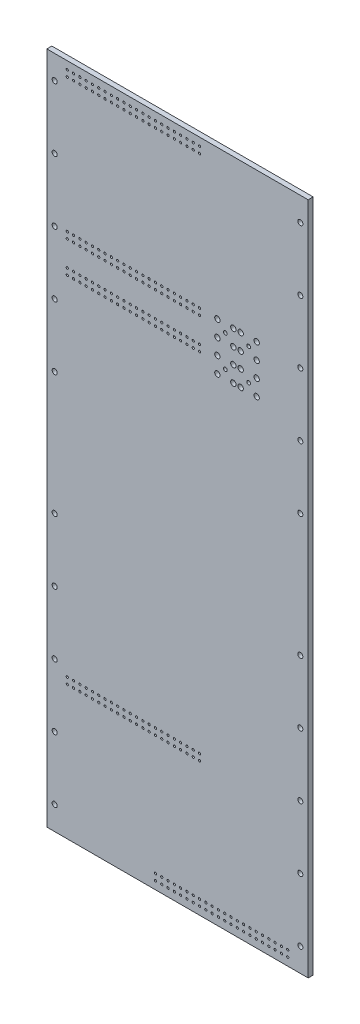
from build123d import *

# Parameters (mm, degrees)
SKETCH1_W                 = 83
SKETCH1_H                 = 214
BOSS_EXTRUDE1_DEPTH       = 1.5875
F_0_CLEARANCE_HOLE1_D     = 1.6129
F_0_CLEARANCE_HOLE1_DEPTH = 3.175
F_0_CLEARANCE_HOLE1_TIP   = 0.484564046
SKETCH6_W                 = 72.5
SKETCH6_H                 = 7
BOSS_EXTRUDE3_DEPTH       = 4.9125
SKETCH7_R                 = 0.35
SKETCH7_R_2               = 0.5842
SKETCH7_R_3               = 0.8509
CUT_EXTRUDE1_DEPTH        = 115.949989126


with BuildPart() as part:
    # Sketch1 → Boss-Extrude1 (new body)
    with BuildSketch(Plane.XY):
        Rectangle(SKETCH1_W, SKETCH1_H)
    extrude(amount=BOSS_EXTRUDE1_DEPTH)

    # #0 Clearance Hole1
    with Locations(Plane.XY.offset(1.5875)):
        with Locations((-39, 99.5), (39, 99.5), (39, 79.5), (39, 59.5), (39, 39.5), (39, 19.5), (-39, 79.5), (-39, 59.5), (-39, 39.5), (-39, 19.5), (-39, -19.5), (-39, -39.5), (-39, -59.5), (-39, -79.5), (39, -19.5), (39, -39.5), (39, -59.5), (39, -79.5), (39, -99.5), (-39, -99.5)):
            Hole(F_0_CLEARANCE_HOLE1_D / 2, depth=F_0_CLEARANCE_HOLE1_DEPTH)
            with Locations((0, 0, -(F_0_CLEARANCE_HOLE1_DEPTH + F_0_CLEARANCE_HOLE1_TIP / 2))):  # 118° drill point
                Cone(0, F_0_CLEARANCE_HOLE1_D / 2, F_0_CLEARANCE_HOLE1_TIP, mode=Mode.SUBTRACT)

    # Sketch6 → Boss-Extrude3 (add)
    with BuildSketch(Plane(origin=(0, 0, 0), x_dir=(-1, 0, 0), z_dir=(0, 0, -1))):
        with Locations((0.05, -3.5)):
            Rectangle(SKETCH6_W, SKETCH6_H)
    extrude(amount=BOSS_EXTRUDE3_DEPTH)

    # Sketch7 → Cut-Extrude1 (cut, through all)
    with BuildSketch(Plane.XY.offset(1.5875)):
        with Locations((-35, 102.5)):
            Circle(SKETCH7_R)
        with Locations((-33, 102.5)):
            Circle(SKETCH7_R)
        with Locations((-31, 102.5)):
            Circle(SKETCH7_R)
        with Locations((-29, 102.5)):
            Circle(SKETCH7_R)
        with Locations((-27, 102.5)):
            Circle(SKETCH7_R)
        with Locations((-25, 102.5)):
            Circle(SKETCH7_R)
        with Locations((-23, 102.5)):
            Circle(SKETCH7_R)
        with Locations((-21, 102.5)):
            Circle(SKETCH7_R)
        with Locations((-19, 102.5)):
            Circle(SKETCH7_R)
        with Locations((-17, 102.5)):
            Circle(SKETCH7_R)
        with Locations((-15, 102.5)):
            Circle(SKETCH7_R)
        with Locations((-13, 102.5)):
            Circle(SKETCH7_R)
        with Locations((-11, 102.5)):
            Circle(SKETCH7_R)
        with Locations((-9, 102.5)):
            Circle(SKETCH7_R)
        with Locations((-7, 102.5)):
            Circle(SKETCH7_R)
        with Locations((-5, 102.5)):
            Circle(SKETCH7_R)
        with Locations((-3, 102.5)):
            Circle(SKETCH7_R)
        with Locations((-1, 102.5)):
            Circle(SKETCH7_R)
        with Locations((1, 102.5)):
            Circle(SKETCH7_R)
        with Locations((3, 102.5)):
            Circle(SKETCH7_R)
        with Locations((5, 102.5)):
            Circle(SKETCH7_R)
        with Locations((7, 102.5)):
            Circle(SKETCH7_R)
        with Locations((-33, 104.5)):
            Circle(SKETCH7_R)
        with Locations((-31, 104.5)):
            Circle(SKETCH7_R)
        with Locations((-29, 104.5)):
            Circle(SKETCH7_R)
        with Locations((-27, 104.5)):
            Circle(SKETCH7_R)
        with Locations((-25, 104.5)):
            Circle(SKETCH7_R)
        with Locations((-23, 104.5)):
            Circle(SKETCH7_R)
        with Locations((-21, 104.5)):
            Circle(SKETCH7_R)
        with Locations((-19, 104.5)):
            Circle(SKETCH7_R)
        with Locations((-17, 104.5)):
            Circle(SKETCH7_R)
        with Locations((-15, 104.5)):
            Circle(SKETCH7_R)
        with Locations((-13, 104.5)):
            Circle(SKETCH7_R)
        with Locations((-11, 104.5)):
            Circle(SKETCH7_R)
        with Locations((-9, 104.5)):
            Circle(SKETCH7_R)
        with Locations((-7, 104.5)):
            Circle(SKETCH7_R)
        with Locations((-5, 104.5)):
            Circle(SKETCH7_R)
        with Locations((-3, 104.5)):
            Circle(SKETCH7_R)
        with Locations((-1, 104.5)):
            Circle(SKETCH7_R)
        with Locations((1, 104.5)):
            Circle(SKETCH7_R)
        with Locations((3, 104.5)):
            Circle(SKETCH7_R)
        with Locations((5, 104.5)):
            Circle(SKETCH7_R)
        with Locations((7, 104.5)):
            Circle(SKETCH7_R)
        with Locations((-35, 104.5)):
            Circle(SKETCH7_R)
        with Locations((-35, 58)):
            Circle(SKETCH7_R)
        with Locations((-33, 58)):
            Circle(SKETCH7_R)
        with Locations((-31, 58)):
            Circle(SKETCH7_R)
        with Locations((-29, 58)):
            Circle(SKETCH7_R)
        with Locations((-27, 58)):
            Circle(SKETCH7_R)
        with Locations((-25, 58)):
            Circle(SKETCH7_R)
        with Locations((-23, 58)):
            Circle(SKETCH7_R)
        with Locations((-21, 58)):
            Circle(SKETCH7_R)
        with Locations((-19, 58)):
            Circle(SKETCH7_R)
        with Locations((-17, 58)):
            Circle(SKETCH7_R)
        with Locations((-15, 58)):
            Circle(SKETCH7_R)
        with Locations((-13, 58)):
            Circle(SKETCH7_R)
        with Locations((-11, 58)):
            Circle(SKETCH7_R)
        with Locations((-9, 58)):
            Circle(SKETCH7_R)
        with Locations((-7, 58)):
            Circle(SKETCH7_R)
        with Locations((-5, 58)):
            Circle(SKETCH7_R)
        with Locations((-3, 58)):
            Circle(SKETCH7_R)
        with Locations((-1, 58)):
            Circle(SKETCH7_R)
        with Locations((1, 58)):
            Circle(SKETCH7_R)
        with Locations((3, 58)):
            Circle(SKETCH7_R)
        with Locations((5, 58)):
            Circle(SKETCH7_R)
        with Locations((7, 58)):
            Circle(SKETCH7_R)
        with Locations((-33, 60)):
            Circle(SKETCH7_R)
        with Locations((-31, 60)):
            Circle(SKETCH7_R)
        with Locations((-29, 60)):
            Circle(SKETCH7_R)
        with Locations((-27, 60)):
            Circle(SKETCH7_R)
        with Locations((-25, 60)):
            Circle(SKETCH7_R)
        with Locations((-23, 60)):
            Circle(SKETCH7_R)
        with Locations((-21, 60)):
            Circle(SKETCH7_R)
        with Locations((-19, 60)):
            Circle(SKETCH7_R)
        with Locations((-17, 60)):
            Circle(SKETCH7_R)
        with Locations((-15, 60)):
            Circle(SKETCH7_R)
        with Locations((-13, 60)):
            Circle(SKETCH7_R)
        with Locations((-11, 60)):
            Circle(SKETCH7_R)
        with Locations((-9, 60)):
            Circle(SKETCH7_R)
        with Locations((-7, 60)):
            Circle(SKETCH7_R)
        with Locations((-5, 60)):
            Circle(SKETCH7_R)
        with Locations((-3, 60)):
            Circle(SKETCH7_R)
        with Locations((-1, 60)):
            Circle(SKETCH7_R)
        with Locations((1, 60)):
            Circle(SKETCH7_R)
        with Locations((3, 60)):
            Circle(SKETCH7_R)
        with Locations((5, 60)):
            Circle(SKETCH7_R)
        with Locations((7, 60)):
            Circle(SKETCH7_R)
        with Locations((-35, 60)):
            Circle(SKETCH7_R)
        with Locations((15.2, 57.24)):
            Circle(SKETCH7_R_2)
        with Locations((12.66, 59.78)):
            Circle(SKETCH7_R_3)
        with Locations((17.74, 59.78)):
            Circle(SKETCH7_R_3)
        with Locations((17.74, 54.7)):
            Circle(SKETCH7_R_3)
        with Locations((12.66, 54.7)):
            Circle(SKETCH7_R_3)
        with Locations((-35, -64.5)):
            Circle(SKETCH7_R)
        with Locations((-33, -64.5)):
            Circle(SKETCH7_R)
        with Locations((-31, -64.5)):
            Circle(SKETCH7_R)
        with Locations((-29, -64.5)):
            Circle(SKETCH7_R)
        with Locations((-27, -64.5)):
            Circle(SKETCH7_R)
        with Locations((-25, -64.5)):
            Circle(SKETCH7_R)
        with Locations((-23, -64.5)):
            Circle(SKETCH7_R)
        with Locations((-21, -64.5)):
            Circle(SKETCH7_R)
        with Locations((-19, -64.5)):
            Circle(SKETCH7_R)
        with Locations((-17, -64.5)):
            Circle(SKETCH7_R)
        with Locations((-15, -64.5)):
            Circle(SKETCH7_R)
        with Locations((-13, -64.5)):
            Circle(SKETCH7_R)
        with Locations((-11, -64.5)):
            Circle(SKETCH7_R)
        with Locations((-9, -64.5)):
            Circle(SKETCH7_R)
        with Locations((-7, -64.5)):
            Circle(SKETCH7_R)
        with Locations((-5, -64.5)):
            Circle(SKETCH7_R)
        with Locations((-3, -64.5)):
            Circle(SKETCH7_R)
        with Locations((-1, -64.5)):
            Circle(SKETCH7_R)
        with Locations((1, -64.5)):
            Circle(SKETCH7_R)
        with Locations((3, -64.5)):
            Circle(SKETCH7_R)
        with Locations((5, -64.5)):
            Circle(SKETCH7_R)
        with Locations((7, -64.5)):
            Circle(SKETCH7_R)
        with Locations((-33, -62.5)):
            Circle(SKETCH7_R)
        with Locations((-31, -62.5)):
            Circle(SKETCH7_R)
        with Locations((-29, -62.5)):
            Circle(SKETCH7_R)
        with Locations((-27, -62.5)):
            Circle(SKETCH7_R)
        with Locations((-25, -62.5)):
            Circle(SKETCH7_R)
        with Locations((-23, -62.5)):
            Circle(SKETCH7_R)
        with Locations((-21, -62.5)):
            Circle(SKETCH7_R)
        with Locations((-19, -62.5)):
            Circle(SKETCH7_R)
        with Locations((-17, -62.5)):
            Circle(SKETCH7_R)
        with Locations((-15, -62.5)):
            Circle(SKETCH7_R)
        with Locations((-13, -62.5)):
            Circle(SKETCH7_R)
        with Locations((-11, -62.5)):
            Circle(SKETCH7_R)
        with Locations((-9, -62.5)):
            Circle(SKETCH7_R)
        with Locations((-7, -62.5)):
            Circle(SKETCH7_R)
        with Locations((-5, -62.5)):
            Circle(SKETCH7_R)
        with Locations((-3, -62.5)):
            Circle(SKETCH7_R)
        with Locations((-1, -62.5)):
            Circle(SKETCH7_R)
        with Locations((1, -62.5)):
            Circle(SKETCH7_R)
        with Locations((3, -62.5)):
            Circle(SKETCH7_R)
        with Locations((5, -62.5)):
            Circle(SKETCH7_R)
        with Locations((7, -62.5)):
            Circle(SKETCH7_R)
        with Locations((-35, -62.5)):
            Circle(SKETCH7_R)
        with Locations((-7, -104.5)):
            Circle(SKETCH7_R)
        with Locations((-5, -104.5)):
            Circle(SKETCH7_R)
        with Locations((-3, -104.5)):
            Circle(SKETCH7_R)
        with Locations((-1, -104.5)):
            Circle(SKETCH7_R)
        with Locations((1, -104.5)):
            Circle(SKETCH7_R)
        with Locations((3, -104.5)):
            Circle(SKETCH7_R)
        with Locations((5, -104.5)):
            Circle(SKETCH7_R)
        with Locations((7, -104.5)):
            Circle(SKETCH7_R)
        with Locations((9, -104.5)):
            Circle(SKETCH7_R)
        with Locations((11, -104.5)):
            Circle(SKETCH7_R)
        with Locations((13, -104.5)):
            Circle(SKETCH7_R)
        with Locations((15, -104.5)):
            Circle(SKETCH7_R)
        with Locations((17, -104.5)):
            Circle(SKETCH7_R)
        with Locations((19, -104.5)):
            Circle(SKETCH7_R)
        with Locations((21, -104.5)):
            Circle(SKETCH7_R)
        with Locations((23, -104.5)):
            Circle(SKETCH7_R)
        with Locations((25, -104.5)):
            Circle(SKETCH7_R)
        with Locations((27, -104.5)):
            Circle(SKETCH7_R)
        with Locations((29, -104.5)):
            Circle(SKETCH7_R)
        with Locations((31, -104.5)):
            Circle(SKETCH7_R)
        with Locations((33, -104.5)):
            Circle(SKETCH7_R)
        with Locations((35, -104.5)):
            Circle(SKETCH7_R)
        with Locations((-5, -102.5)):
            Circle(SKETCH7_R)
        with Locations((-3, -102.5)):
            Circle(SKETCH7_R)
        with Locations((-1, -102.5)):
            Circle(SKETCH7_R)
        with Locations((1, -102.5)):
            Circle(SKETCH7_R)
        with Locations((3, -102.5)):
            Circle(SKETCH7_R)
        with Locations((5, -102.5)):
            Circle(SKETCH7_R)
        with Locations((7, -102.5)):
            Circle(SKETCH7_R)
        with Locations((9, -102.5)):
            Circle(SKETCH7_R)
        with Locations((11, -102.5)):
            Circle(SKETCH7_R)
        with Locations((13, -102.5)):
            Circle(SKETCH7_R)
        with Locations((15, -102.5)):
            Circle(SKETCH7_R)
        with Locations((17, -102.5)):
            Circle(SKETCH7_R)
        with Locations((19, -102.5)):
            Circle(SKETCH7_R)
        with Locations((21, -102.5)):
            Circle(SKETCH7_R)
        with Locations((23, -102.5)):
            Circle(SKETCH7_R)
        with Locations((25, -102.5)):
            Circle(SKETCH7_R)
        with Locations((27, -102.5)):
            Circle(SKETCH7_R)
        with Locations((29, -102.5)):
            Circle(SKETCH7_R)
        with Locations((31, -102.5)):
            Circle(SKETCH7_R)
        with Locations((33, -102.5)):
            Circle(SKETCH7_R)
        with Locations((35, -102.5)):
            Circle(SKETCH7_R)
        with Locations((-7, -102.5)):
            Circle(SKETCH7_R)
        with Locations((22.6, 57.24)):
            Circle(SKETCH7_R_2)
        with Locations((20.06, 59.78)):
            Circle(SKETCH7_R_3)
        with Locations((25.14, 59.78)):
            Circle(SKETCH7_R_3)
        with Locations((25.14, 54.7)):
            Circle(SKETCH7_R_3)
        with Locations((20.06, 54.7)):
            Circle(SKETCH7_R_3)
        with Locations((-35, 48)):
            Circle(SKETCH7_R)
        with Locations((-33, 48)):
            Circle(SKETCH7_R)
        with Locations((-31, 48)):
            Circle(SKETCH7_R)
        with Locations((-29, 48)):
            Circle(SKETCH7_R)
        with Locations((-27, 48)):
            Circle(SKETCH7_R)
        with Locations((-25, 48)):
            Circle(SKETCH7_R)
        with Locations((-23, 48)):
            Circle(SKETCH7_R)
        with Locations((-21, 48)):
            Circle(SKETCH7_R)
        with Locations((-19, 48)):
            Circle(SKETCH7_R)
        with Locations((-17, 48)):
            Circle(SKETCH7_R)
        with Locations((-15, 48)):
            Circle(SKETCH7_R)
        with Locations((-13, 48)):
            Circle(SKETCH7_R)
        with Locations((-11, 48)):
            Circle(SKETCH7_R)
        with Locations((-9, 48)):
            Circle(SKETCH7_R)
        with Locations((-7, 48)):
            Circle(SKETCH7_R)
        with Locations((-5, 48)):
            Circle(SKETCH7_R)
        with Locations((-3, 48)):
            Circle(SKETCH7_R)
        with Locations((-1, 48)):
            Circle(SKETCH7_R)
        with Locations((1, 48)):
            Circle(SKETCH7_R)
        with Locations((3, 48)):
            Circle(SKETCH7_R)
        with Locations((5, 48)):
            Circle(SKETCH7_R)
        with Locations((7, 48)):
            Circle(SKETCH7_R)
        with Locations((-33, 50)):
            Circle(SKETCH7_R)
        with Locations((-31, 50)):
            Circle(SKETCH7_R)
        with Locations((-29, 50)):
            Circle(SKETCH7_R)
        with Locations((-27, 50)):
            Circle(SKETCH7_R)
        with Locations((-25, 50)):
            Circle(SKETCH7_R)
        with Locations((-23, 50)):
            Circle(SKETCH7_R)
        with Locations((-21, 50)):
            Circle(SKETCH7_R)
        with Locations((-19, 50)):
            Circle(SKETCH7_R)
        with Locations((-17, 50)):
            Circle(SKETCH7_R)
        with Locations((-15, 50)):
            Circle(SKETCH7_R)
        with Locations((-13, 50)):
            Circle(SKETCH7_R)
        with Locations((-11, 50)):
            Circle(SKETCH7_R)
        with Locations((-9, 50)):
            Circle(SKETCH7_R)
        with Locations((-7, 50)):
            Circle(SKETCH7_R)
        with Locations((-5, 50)):
            Circle(SKETCH7_R)
        with Locations((-3, 50)):
            Circle(SKETCH7_R)
        with Locations((-1, 50)):
            Circle(SKETCH7_R)
        with Locations((1, 50)):
            Circle(SKETCH7_R)
        with Locations((3, 50)):
            Circle(SKETCH7_R)
        with Locations((5, 50)):
            Circle(SKETCH7_R)
        with Locations((7, 50)):
            Circle(SKETCH7_R)
        with Locations((-35, 50)):
            Circle(SKETCH7_R)
        with Locations((15.2, 47.24)):
            Circle(SKETCH7_R_2)
        with Locations((12.66, 49.78)):
            Circle(SKETCH7_R_3)
        with Locations((17.74, 49.78)):
            Circle(SKETCH7_R_3)
        with Locations((17.74, 44.7)):
            Circle(SKETCH7_R_3)
        with Locations((12.66, 44.7)):
            Circle(SKETCH7_R_3)
        with Locations((22.6, 47.24)):
            Circle(SKETCH7_R_2)
        with Locations((20.06, 49.78)):
            Circle(SKETCH7_R_3)
        with Locations((25.14, 49.78)):
            Circle(SKETCH7_R_3)
        with Locations((25.14, 44.7)):
            Circle(SKETCH7_R_3)
        with Locations((20.06, 44.7)):
            Circle(SKETCH7_R_3)
    extrude(amount=-CUT_EXTRUDE1_DEPTH, mode=Mode.SUBTRACT)


solid = part.part
